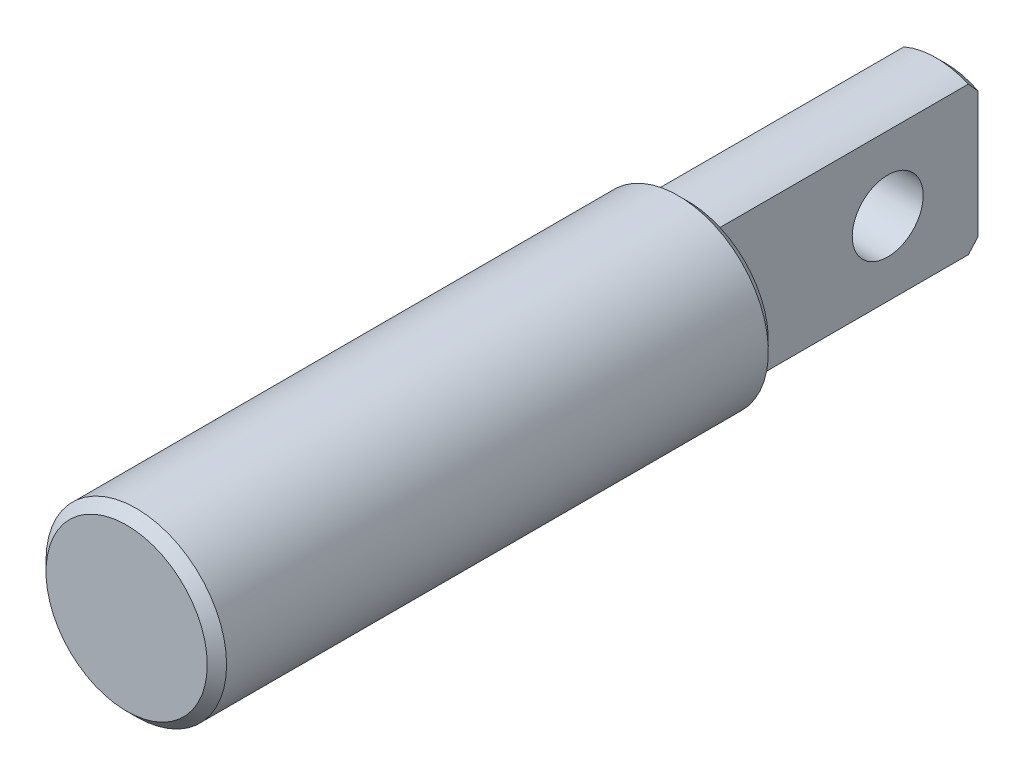
from build123d import *

# Parameters (mm, degrees)
ESQUISSE1_R             = 14
EXTRUSION1_DEPTH        = 127
CHANFREIN1_SIZE         = 1.5
ESQUISSE2_OUTSIDE_W     = 56.606
ESQUISSE2_OUTSIDE_H     = 56.606
ESQUISSE2_OUTSIDE_R     = 12.5
ENL_V_MAT_EXTRU_1_DEPTH = 40
ESQUISSE3_OUTSIDE_W     = 56.606
ESQUISSE3_OUTSIDE_H     = 56.606
ESQUISSE3_OUTSIDE_W_2   = 10
ESQUISSE3_OUTSIDE_H_2   = 28.179824561
ENL_V_MAT_EXTRU_2_DEPTH = 40
CHANFREIN2_SIZE         = 1.5
CHANFREIN3_SIZE         = 1.5
ESQUISSE4_R             = 5.5
ENL_V_MAT_EXTRU_3_DEPTH = 23


with BuildPart() as part:
    # Esquisse1 → Extrusion1 (new body)
    with BuildSketch(Plane.XY):
        Circle(ESQUISSE1_R)
    extrude(amount=EXTRUSION1_DEPTH)

    # Chanfrein1
    chanfrein1_edges = [part.edges().sort_by_distance(p)[0] for p in [
        (-14, 0, 127),
    ]]
    chamfer(chanfrein1_edges, length=CHANFREIN1_SIZE)

    # Esquisse2 outside → Enlèv. mat.-Extru.1 (cut)
    with BuildSketch(Plane(origin=(0, 0, 0), x_dir=(-1, 0, 0), z_dir=(0, 0, -1))):
        Rectangle(ESQUISSE2_OUTSIDE_W, ESQUISSE2_OUTSIDE_H)
        Circle(ESQUISSE2_OUTSIDE_R, mode=Mode.SUBTRACT)
    extrude(amount=-ENL_V_MAT_EXTRU_1_DEPTH, mode=Mode.SUBTRACT)

    # Esquisse3 outside → Enlèv. mat.-Extru.2 (cut)
    with BuildSketch(Plane.XY):
        Rectangle(ESQUISSE3_OUTSIDE_W, ESQUISSE3_OUTSIDE_H)
        with Locations((0, 0.328947369)):
            Rectangle(ESQUISSE3_OUTSIDE_W_2, ESQUISSE3_OUTSIDE_H_2, mode=Mode.SUBTRACT)
    extrude(amount=ENL_V_MAT_EXTRU_2_DEPTH, mode=Mode.SUBTRACT)

    # Chanfrein2
    chanfrein2_edges = [part.edges().sort_by_distance(p)[0] for p in [
        (0, 12.5, 0),
        (0, -12.5, 0),
    ]]
    chamfer(chanfrein2_edges, length=CHANFREIN2_SIZE)

    # Chanfrein3
    chanfrein3_edges = [part.edges().sort_by_distance(p)[0] for p in [
        (-14, 0, 40),
    ]]
    chamfer(chanfrein3_edges, length=CHANFREIN3_SIZE - 0.0001)  # a hair under: the kernel refuses the full size

    # Esquisse4 → Enlèv. mat.-Extru.3 (cut)
    with BuildSketch(Plane.ZY.offset(5)):
        with Locations(Location((14, 0, 0), (0, 0, 270))):
            Circle(ESQUISSE4_R)
    extrude(amount=-ENL_V_MAT_EXTRU_3_DEPTH, mode=Mode.SUBTRACT)


solid = part.part
